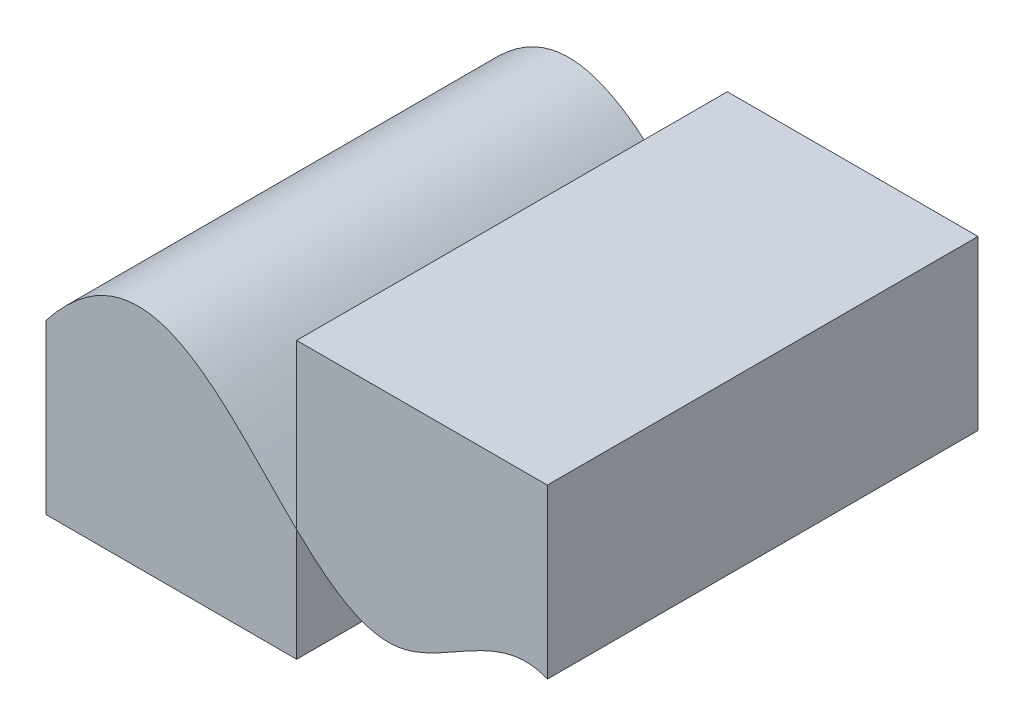
from build123d import *

# Parameters (mm, degrees)
SKETCH1_W           = 145.880200278
SKETCH1_H           = 125.32663254
BOSS_EXTRUDE1_DEPTH = 80.374704292
INTERSECT1_START    = -62.66331627
INTERSECT1_DEPTH    = 125.32663254


# Read off the part's stored shape, not the designer's step: Intersect1
with BuildPart() as part:
    # Sketch1 → Boss-Extrude1 (new body)
    with BuildSketch(Plane(origin=(0, 0, 0), x_dir=(1, 0, 0), z_dir=(0, 1, 0))):
        Rectangle(SKETCH1_W, SKETCH1_H)
    extrude(amount=BOSS_EXTRUDE1_DEPTH)

    # Intersect1 outline → Intersect1 (cut)
    with BuildSketch(Plane.XY.offset(INTERSECT1_START)):
        with BuildLine():
            Line((-72.940100139, 80.374704292), (-72.940100139, 48.931437063))
            add(Edge.make_bspline(
                [(-72.940100139, 48.931437063), (-43.863738313, 86.090121594), (-22.048252395, 53.903227083), (0, 32.685028068)],
                knots=[0.072658952, 0.072658952, 0.072658952, 0.072658952, 0.486913588, 0.486913588, 0.486913588, 0.486913588], degree=3))
            Line((0, 32.685028068), (0, 80.374704292))
            Line((0, 80.374704292), (-72.940100139, 80.374704292))
        make_face()
        with BuildLine():
            add(Edge.make_bspline(
                [(0, 32.685028068), (9.479341915, 23.562556152), (32.238180531, 6.605314214), (58.644645951, 37.689666929), (72.940100139, 31.455238757)],
                knots=[0.486913588, 0.486913588, 0.486913588, 0.486913588, 0.665016653, 0.912587019, 0.912587019, 0.912587019, 0.912587019], degree=3))
            Line((0, 32.685028068), (0, 0))
            Line((0, 0), (72.940100139, 0))
            Line((72.940100139, 0), (72.940100139, 31.455238757))
        make_face()
    extrude(amount=INTERSECT1_DEPTH, mode=Mode.SUBTRACT)


solid = part.part
